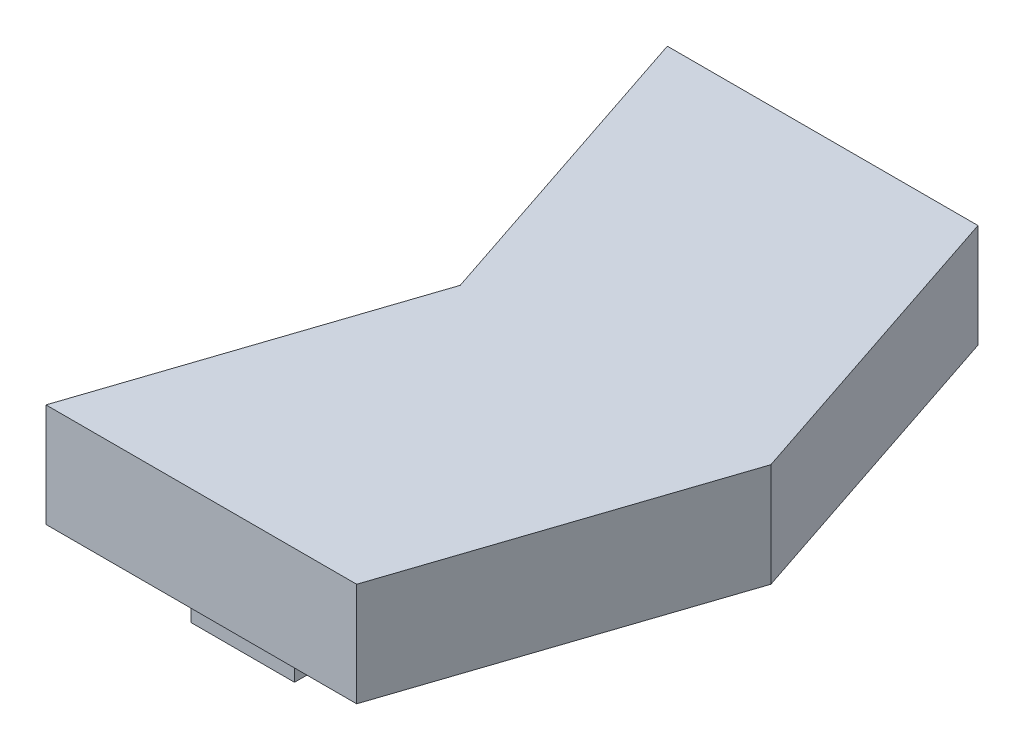
from build123d import *

# Parameters (mm, degrees)
BOSS_EXTRUDE1_DEPTH      = 6.35
SKETCH2_R                = 5.635000033
CUT_EXTRUDE1_DEPTH       = 3.207999934
SKETCH3_W                = 2.54
SKETCH3_H                = 3.81
HAPTIC_WIRE_CUTOUT_DEPTH = 3.207999934
SKETCH4_W                = 6.35
SKETCH4_H                = 2.54
PINS_DEPTH               = 2.032


with BuildPart() as part:
    # Sketch1 → Boss-Extrude1 (new body)
    with BuildSketch(Plane(origin=(0, 0, 0), x_dir=(1, 0, 0), z_dir=(0, 1, 0))):
        Polygon((0, 0), (19.05, 0), (25.4, 19.05), (19.05, 38.1), (0, 38.1), (6.35, 19.05), align=None)
    extrude(amount=BOSS_EXTRUDE1_DEPTH)

    # Sketch2 → Cut-Extrude1 (cut)
    with BuildSketch(Plane.XZ):
        with Locations((15.24, -19.05)):
            Circle(SKETCH2_R)
    extrude(amount=-CUT_EXTRUDE1_DEPTH, mode=Mode.SUBTRACT)

    # Sketch3 → Haptic Wire Cutout (cut)
    with BuildSketch(Plane.XZ):
        with Locations((15.24, -26.445020526)):
            Rectangle(SKETCH3_W, SKETCH3_H)
    extrude(amount=-HAPTIC_WIRE_CUTOUT_DEPTH, mode=Mode.SUBTRACT)

    # Sketch4 → Pins (add)
    with BuildSketch(Plane.XZ):
        with Locations((10.795, -35.56)):
            Rectangle(SKETCH4_W, SKETCH4_H)
    pins = extrude(amount=PINS_DEPTH)

    # Mirror1: Pins across plane
    add(pins.mirror(Plane(origin=(0, 0, -19.05), x_dir=(1, 0, 0), z_dir=(0, 0, -1))))


solid = part.part
